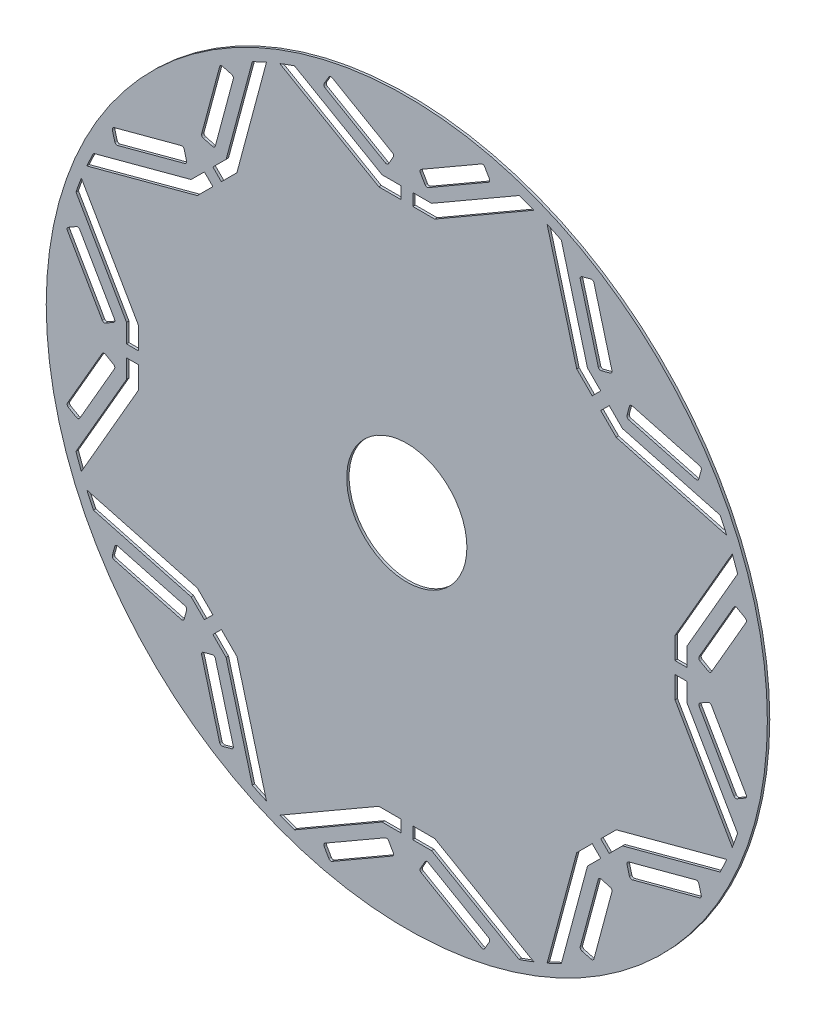
from build123d import *

# Parameters (mm, degrees)
ROTOR_SKETCH_R      = 45
ROTOR_SKETCH_R_2    = 7.5
BOSS_EXTRUDE1_DEPTH = 0.15
CUT_EXTRUDE1_DEPTH  = 64.64031741


with BuildPart() as part:
    # Rotor sketch → Boss-Extrude1 (new, symmetric)
    with BuildSketch(Plane.XY):
        Circle(ROTOR_SKETCH_R)
        Circle(ROTOR_SKETCH_R_2, mode=Mode.SUBTRACT)
        with BuildLine():
            Line((2.683949748, 36.477135035), (10.201050252, 40.817135035))
            ThreePointArc((10.201050252, 40.817135035), (10.340828, 40.999296943), (10.310857874, 41.226942656))
            Line((10.310857874, 41.226942656), (9.725857874, 42.240192379))
            ThreePointArc((9.725857874, 42.240192379), (9.543695966, 42.379970127), (9.316050252, 42.35))
            Line((9.316050252, 42.35), (1.798949748, 38.01))
            ThreePointArc((1.798949748, 38.01), (1.659172, 37.827838092), (1.689142126, 37.600192379))
            Line((1.689142126, 37.600192379), (2.274142126, 36.586942656))
            ThreePointArc((2.274142126, 36.586942656), (2.456304034, 36.447164909), (2.683949748, 36.477135035))
        make_face(mode=Mode.SUBTRACT)
        with BuildLine():
            Line((-1.798949748, 38.01), (-9.316050252, 42.35))
            ThreePointArc((-9.316050252, 42.35), (-9.543695966, 42.379970127), (-9.725857874, 42.240192379))
            Line((-9.725857874, 42.240192379), (-10.310857874, 41.226942656))
            ThreePointArc((-10.310857874, 41.226942656), (-10.340828, 40.999296943), (-10.201050252, 40.817135035))
            Line((-10.201050252, 40.817135035), (-2.683949748, 36.477135035))
            ThreePointArc((-2.683949748, 36.477135035), (-2.456304034, 36.447164909), (-2.274142126, 36.586942656))
            Line((-2.274142126, 36.586942656), (-1.689142126, 37.600192379))
            ThreePointArc((-1.689142126, 37.600192379), (-1.659172, 37.827838092), (-1.798949748, 38.01))
        make_face(mode=Mode.SUBTRACT)
        with BuildLine():
            Line((25.605079187, 28.149178318), (23.358529876, 36.533414491))
            ThreePointArc((23.358529876, 36.533414491), (23.218752128, 36.715576398), (22.991106414, 36.745546525))
            Line((22.991106414, 36.745546525), (21.860973198, 36.442728242))
            ThreePointArc((21.860973198, 36.442728242), (21.67881129, 36.302950494), (21.648841163, 36.075304781))
            Line((21.648841163, 36.075304781), (23.895390475, 27.691068609))
            ThreePointArc((23.895390475, 27.691068609), (24.035168223, 27.508906701), (24.262813936, 27.478936574))
            Line((24.262813936, 27.478936574), (25.392947153, 27.781754857))
            ThreePointArc((25.392947153, 27.781754857), (25.575109061, 27.921532605), (25.605079187, 28.149178318))
        make_face(mode=Mode.SUBTRACT)
        with BuildLine():
            Line((27.478936574, 24.262813936), (27.781754857, 25.392947153))
            ThreePointArc((27.781754857, 25.392947153), (27.921532605, 25.575109061), (28.149178318, 25.605079187))
            Line((28.149178318, 25.605079187), (36.533414491, 23.358529876))
            ThreePointArc((36.533414491, 23.358529876), (36.715576398, 23.218752128), (36.745546525, 22.991106414))
            Line((36.745546525, 22.991106414), (36.442728242, 21.860973198))
            ThreePointArc((36.442728242, 21.860973198), (36.302950494, 21.67881129), (36.075304781, 21.648841163))
            Line((36.075304781, 21.648841163), (27.691068609, 23.895390475))
            ThreePointArc((27.691068609, 23.895390475), (27.508906701, 24.035168223), (27.478936574, 24.262813936))
        make_face(mode=Mode.SUBTRACT)
        with BuildLine():
            Line((38.01, 1.798949748), (42.35, 9.316050252))
            ThreePointArc((42.35, 9.316050252), (42.379970127, 9.543695966), (42.240192379, 9.725857874))
            Line((42.240192379, 9.725857874), (41.226942656, 10.310857874))
            ThreePointArc((41.226942656, 10.310857874), (40.999296943, 10.340828), (40.817135035, 10.201050252))
            Line((40.817135035, 10.201050252), (36.477135035, 2.683949748))
            ThreePointArc((36.477135035, 2.683949748), (36.447164909, 2.456304034), (36.586942656, 2.274142126))
            Line((36.586942656, 2.274142126), (37.600192379, 1.689142126))
            ThreePointArc((37.600192379, 1.689142126), (37.827838092, 1.659172), (38.01, 1.798949748))
        make_face(mode=Mode.SUBTRACT)
        with BuildLine():
            Line((36.586942656, -2.274142126), (37.600192379, -1.689142126))
            ThreePointArc((37.600192379, -1.689142126), (37.827838092, -1.659172), (38.01, -1.798949748))
            Line((38.01, -1.798949748), (42.35, -9.316050252))
            ThreePointArc((42.35, -9.316050252), (42.379970127, -9.543695966), (42.240192379, -9.725857874))
            Line((42.240192379, -9.725857874), (41.226942656, -10.310857874))
            ThreePointArc((41.226942656, -10.310857874), (40.999296943, -10.340828), (40.817135035, -10.201050252))
            Line((40.817135035, -10.201050252), (36.477135035, -2.683949748))
            ThreePointArc((36.477135035, -2.683949748), (36.447164909, -2.456304034), (36.586942656, -2.274142126))
        make_face(mode=Mode.SUBTRACT)
        with BuildLine():
            Line((28.149178318, -25.605079187), (36.533414491, -23.358529876))
            ThreePointArc((36.533414491, -23.358529876), (36.715576398, -23.218752128), (36.745546525, -22.991106414))
            Line((36.745546525, -22.991106414), (36.442728242, -21.860973198))
            ThreePointArc((36.442728242, -21.860973198), (36.302950494, -21.67881129), (36.075304781, -21.648841163))
            Line((36.075304781, -21.648841163), (27.691068609, -23.895390475))
            ThreePointArc((27.691068609, -23.895390475), (27.508906701, -24.035168223), (27.478936574, -24.262813936))
            Line((27.478936574, -24.262813936), (27.781754857, -25.392947153))
            ThreePointArc((27.781754857, -25.392947153), (27.921532605, -25.575109061), (28.149178318, -25.605079187))
        make_face(mode=Mode.SUBTRACT)
        with BuildLine():
            Line((24.262813936, -27.478936574), (25.392947153, -27.781754857))
            ThreePointArc((25.392947153, -27.781754857), (25.575109061, -27.921532605), (25.605079187, -28.149178318))
            Line((25.605079187, -28.149178318), (23.358529876, -36.533414491))
            ThreePointArc((23.358529876, -36.533414491), (23.218752128, -36.715576398), (22.991106414, -36.745546525))
            Line((22.991106414, -36.745546525), (21.860973198, -36.442728242))
            ThreePointArc((21.860973198, -36.442728242), (21.67881129, -36.302950494), (21.648841163, -36.075304781))
            Line((21.648841163, -36.075304781), (23.895390475, -27.691068609))
            ThreePointArc((23.895390475, -27.691068609), (24.035168223, -27.508906701), (24.262813936, -27.478936574))
        make_face(mode=Mode.SUBTRACT)
        with BuildLine():
            Line((1.798949748, -38.01), (9.316050252, -42.35))
            ThreePointArc((9.316050252, -42.35), (9.543695966, -42.379970127), (9.725857874, -42.240192379))
            Line((9.725857874, -42.240192379), (10.310857874, -41.226942656))
            ThreePointArc((10.310857874, -41.226942656), (10.340828, -40.999296943), (10.201050252, -40.817135035))
            Line((10.201050252, -40.817135035), (2.683949748, -36.477135035))
            ThreePointArc((2.683949748, -36.477135035), (2.456304034, -36.447164909), (2.274142126, -36.586942656))
            Line((2.274142126, -36.586942656), (1.689142126, -37.600192379))
            ThreePointArc((1.689142126, -37.600192379), (1.659172, -37.827838092), (1.798949748, -38.01))
        make_face(mode=Mode.SUBTRACT)
        with BuildLine():
            Line((-2.274142126, -36.586942656), (-1.689142126, -37.600192379))
            ThreePointArc((-1.689142126, -37.600192379), (-1.659172, -37.827838092), (-1.798949748, -38.01))
            Line((-1.798949748, -38.01), (-9.316050252, -42.35))
            ThreePointArc((-9.316050252, -42.35), (-9.543695966, -42.379970127), (-9.725857874, -42.240192379))
            Line((-9.725857874, -42.240192379), (-10.310857874, -41.226942656))
            ThreePointArc((-10.310857874, -41.226942656), (-10.340828, -40.999296943), (-10.201050252, -40.817135035))
            Line((-10.201050252, -40.817135035), (-2.683949748, -36.477135035))
            ThreePointArc((-2.683949748, -36.477135035), (-2.456304034, -36.447164909), (-2.274142126, -36.586942656))
        make_face(mode=Mode.SUBTRACT)
        with BuildLine():
            Line((-25.605079187, -28.149178318), (-23.358529876, -36.533414491))
            ThreePointArc((-23.358529876, -36.533414491), (-23.218752128, -36.715576398), (-22.991106414, -36.745546525))
            Line((-22.991106414, -36.745546525), (-21.860973198, -36.442728242))
            ThreePointArc((-21.860973198, -36.442728242), (-21.67881129, -36.302950494), (-21.648841163, -36.075304781))
            Line((-21.648841163, -36.075304781), (-23.895390475, -27.691068609))
            ThreePointArc((-23.895390475, -27.691068609), (-24.035168223, -27.508906701), (-24.262813936, -27.478936574))
            Line((-24.262813936, -27.478936574), (-25.392947153, -27.781754857))
            ThreePointArc((-25.392947153, -27.781754857), (-25.575109061, -27.921532605), (-25.605079187, -28.149178318))
        make_face(mode=Mode.SUBTRACT)
        with BuildLine():
            Line((-27.478936574, -24.262813936), (-27.781754857, -25.392947153))
            ThreePointArc((-27.781754857, -25.392947153), (-27.921532605, -25.575109061), (-28.149178318, -25.605079187))
            Line((-28.149178318, -25.605079187), (-36.533414491, -23.358529876))
            ThreePointArc((-36.533414491, -23.358529876), (-36.715576398, -23.218752128), (-36.745546525, -22.991106414))
            Line((-36.745546525, -22.991106414), (-36.442728242, -21.860973198))
            ThreePointArc((-36.442728242, -21.860973198), (-36.302950494, -21.67881129), (-36.075304781, -21.648841163))
            Line((-36.075304781, -21.648841163), (-27.691068609, -23.895390475))
            ThreePointArc((-27.691068609, -23.895390475), (-27.508906701, -24.035168223), (-27.478936574, -24.262813936))
        make_face(mode=Mode.SUBTRACT)
        with BuildLine():
            Line((-38.01, -1.798949748), (-42.35, -9.316050252))
            ThreePointArc((-42.35, -9.316050252), (-42.379970127, -9.543695966), (-42.240192379, -9.725857874))
            Line((-42.240192379, -9.725857874), (-41.226942656, -10.310857874))
            ThreePointArc((-41.226942656, -10.310857874), (-40.999296943, -10.340828), (-40.817135035, -10.201050252))
            Line((-40.817135035, -10.201050252), (-36.477135035, -2.683949748))
            ThreePointArc((-36.477135035, -2.683949748), (-36.447164909, -2.456304034), (-36.586942656, -2.274142126))
            Line((-36.586942656, -2.274142126), (-37.600192379, -1.689142126))
            ThreePointArc((-37.600192379, -1.689142126), (-37.827838092, -1.659172), (-38.01, -1.798949748))
        make_face(mode=Mode.SUBTRACT)
        with BuildLine():
            Line((-36.586942656, 2.274142126), (-37.600192379, 1.689142126))
            ThreePointArc((-37.600192379, 1.689142126), (-37.827838092, 1.659172), (-38.01, 1.798949748))
            Line((-38.01, 1.798949748), (-42.35, 9.316050252))
            ThreePointArc((-42.35, 9.316050252), (-42.379970127, 9.543695966), (-42.240192379, 9.725857874))
            Line((-42.240192379, 9.725857874), (-41.226942656, 10.310857874))
            ThreePointArc((-41.226942656, 10.310857874), (-40.999296943, 10.340828), (-40.817135035, 10.201050252))
            Line((-40.817135035, 10.201050252), (-36.477135035, 2.683949748))
            ThreePointArc((-36.477135035, 2.683949748), (-36.447164909, 2.456304034), (-36.586942656, 2.274142126))
        make_face(mode=Mode.SUBTRACT)
        with BuildLine():
            Line((-28.149178318, 25.605079187), (-36.533414491, 23.358529876))
            ThreePointArc((-36.533414491, 23.358529876), (-36.715576398, 23.218752128), (-36.745546525, 22.991106414))
            Line((-36.745546525, 22.991106414), (-36.442728242, 21.860973198))
            ThreePointArc((-36.442728242, 21.860973198), (-36.302950494, 21.67881129), (-36.075304781, 21.648841163))
            Line((-36.075304781, 21.648841163), (-27.691068609, 23.895390475))
            ThreePointArc((-27.691068609, 23.895390475), (-27.508906701, 24.035168223), (-27.478936574, 24.262813936))
            Line((-27.478936574, 24.262813936), (-27.781754857, 25.392947153))
            ThreePointArc((-27.781754857, 25.392947153), (-27.921532605, 25.575109061), (-28.149178318, 25.605079187))
        make_face(mode=Mode.SUBTRACT)
        with BuildLine():
            Line((-24.262813936, 27.478936574), (-25.392947153, 27.781754857))
            ThreePointArc((-25.392947153, 27.781754857), (-25.575109061, 27.921532605), (-25.605079187, 28.149178318))
            Line((-25.605079187, 28.149178318), (-23.358529876, 36.533414491))
            ThreePointArc((-23.358529876, 36.533414491), (-23.218752128, 36.715576398), (-22.991106414, 36.745546525))
            Line((-22.991106414, 36.745546525), (-21.860973198, 36.442728242))
            ThreePointArc((-21.860973198, 36.442728242), (-21.67881129, 36.302950494), (-21.648841163, 36.075304781))
            Line((-21.648841163, 36.075304781), (-23.895390475, 27.691068609))
            ThreePointArc((-23.895390475, 27.691068609), (-24.035168223, 27.508906701), (-24.262813936, 27.478936574))
        make_face(mode=Mode.SUBTRACT)
    extrude(amount=BOSS_EXTRUDE1_DEPTH, both=True)

    # Saliency grooves → Cut-Extrude1 (cut, through all)
    with BuildSketch(Plane.XY.offset(0.15)):
        with BuildLine():
            Line((-15.852588486, 40.61595054), (-3.487797325, 33.477135035))
            Line((-3.487797325, 33.477135035), (-0.75, 33.477135035))
            Line((-0.75, 33.477135035), (-0.75, 34.977135035))
            Line((-0.75, 34.977135035), (-3.085873536, 34.977135035))
            Line((-3.085873536, 34.977135035), (-14.01391281, 41.286441452))
            ThreePointArc((-14.01391281, 41.286441452), (-14.937013237, 40.961514078), (-15.852588486, 40.61595054))
        make_face()
        with BuildLine():
            Line((-21.205664058, 26.138154338), (-17.510341234, 39.929286869))
            ThreePointArc((-17.510341234, 39.929286869), (-18.402101022, 39.526227723), (-19.284589943, 39.103255501))
            Line((-19.284589943, 39.103255501), (-22.550527267, 26.914611473))
            Line((-22.550527267, 26.914611473), (-24.202239284, 25.262899456))
            Line((-24.202239284, 25.262899456), (-23.141579112, 24.202239284))
            Line((-23.141579112, 24.202239284), (-21.205664058, 26.138154338))
        make_face()
        with BuildLine():
            ThreePointArc((15.852588486, 40.61595054), (14.937013237, 40.961514078), (14.01391281, 41.286441452))
            Line((14.01391281, 41.286441452), (3.085873536, 34.977135035))
            Line((3.085873536, 34.977135035), (0.75, 34.977135035))
            Line((0.75, 34.977135035), (0.75, 33.477135035))
            Line((0.75, 33.477135035), (3.487797325, 33.477135035))
            Line((3.487797325, 33.477135035), (15.852588486, 40.61595054))
        make_face()
        with BuildLine():
            Line((-26.914611473, 22.550527267), (-39.103255501, 19.284589943))
            ThreePointArc((-39.103255501, 19.284589943), (-39.526227723, 18.402101022), (-39.929286869, 17.510341234))
            Line((-39.929286869, 17.510341234), (-26.138154338, 21.205664058))
            Line((-26.138154338, 21.205664058), (-24.202239284, 23.141579112))
            Line((-24.202239284, 23.141579112), (-25.262899456, 24.202239284))
            Line((-25.262899456, 24.202239284), (-26.914611473, 22.550527267))
        make_face()
        with BuildLine():
            ThreePointArc((19.284589943, 39.103255501), (18.402101022, 39.526227723), (17.510341234, 39.929286869))
            Line((17.510341234, 39.929286869), (21.205664058, 26.138154338))
            Line((21.205664058, 26.138154338), (23.141579112, 24.202239284))
            Line((23.141579112, 24.202239284), (24.202239284, 25.262899456))
            Line((24.202239284, 25.262899456), (22.550527267, 26.914611473))
            Line((22.550527267, 26.914611473), (19.284589943, 39.103255501))
        make_face()
        with BuildLine():
            Line((-33.477135035, 3.487797325), (-40.61595054, 15.852588486))
            ThreePointArc((-40.61595054, 15.852588486), (-40.961514078, 14.937013237), (-41.286441452, 14.01391281))
            Line((-41.286441452, 14.01391281), (-34.977135035, 3.085873536))
            Line((-34.977135035, 3.085873536), (-34.977135035, 0.75))
            Line((-34.977135035, 0.75), (-33.477135035, 0.75))
            Line((-33.477135035, 0.75), (-33.477135035, 3.487797325))
        make_face()
        with BuildLine():
            ThreePointArc((39.929286869, 17.510341234), (39.526227723, 18.402101022), (39.103255501, 19.284589943))
            Line((39.103255501, 19.284589943), (26.914611473, 22.550527267))
            Line((26.914611473, 22.550527267), (25.262899456, 24.202239284))
            Line((25.262899456, 24.202239284), (24.202239284, 23.141579112))
            Line((24.202239284, 23.141579112), (26.138154338, 21.205664058))
            Line((26.138154338, 21.205664058), (39.929286869, 17.510341234))
        make_face()
        with BuildLine():
            Line((-34.977135035, -3.085873536), (-41.286441452, -14.01391281))
            ThreePointArc((-41.286441452, -14.01391281), (-40.961514078, -14.937013237), (-40.61595054, -15.852588486))
            Line((-40.61595054, -15.852588486), (-33.477135035, -3.487797325))
            Line((-33.477135035, -3.487797325), (-33.477135035, -0.75))
            Line((-33.477135035, -0.75), (-34.977135035, -0.75))
            Line((-34.977135035, -0.75), (-34.977135035, -3.085873536))
        make_face()
        with BuildLine():
            ThreePointArc((41.286441452, 14.01391281), (40.961514078, 14.937013237), (40.61595054, 15.852588486))
            Line((40.61595054, 15.852588486), (33.477135035, 3.487797325))
            Line((33.477135035, 3.487797325), (33.477135035, 0.75))
            Line((33.477135035, 0.75), (34.977135035, 0.75))
            Line((34.977135035, 0.75), (34.977135035, 3.085873536))
            Line((34.977135035, 3.085873536), (41.286441452, 14.01391281))
        make_face()
        with BuildLine():
            Line((-26.138154338, -21.205664058), (-39.929286869, -17.510341234))
            ThreePointArc((-39.929286869, -17.510341234), (-39.526227723, -18.402101022), (-39.103255501, -19.284589943))
            Line((-39.103255501, -19.284589943), (-26.914611473, -22.550527267))
            Line((-26.914611473, -22.550527267), (-25.262899456, -24.202239284))
            Line((-25.262899456, -24.202239284), (-24.202239284, -23.141579112))
            Line((-24.202239284, -23.141579112), (-26.138154338, -21.205664058))
        make_face()
        with BuildLine():
            ThreePointArc((40.61595054, -15.852588486), (40.961514078, -14.937013237), (41.286441452, -14.01391281))
            Line((41.286441452, -14.01391281), (34.977135035, -3.085873536))
            Line((34.977135035, -3.085873536), (34.977135035, -0.75))
            Line((34.977135035, -0.75), (33.477135035, -0.75))
            Line((33.477135035, -0.75), (33.477135035, -3.487797325))
            Line((33.477135035, -3.487797325), (40.61595054, -15.852588486))
        make_face()
        with BuildLine():
            Line((-22.550527267, -26.914611473), (-19.284589943, -39.103255501))
            ThreePointArc((-19.284589943, -39.103255501), (-18.402101022, -39.526227723), (-17.510341234, -39.929286869))
            Line((-17.510341234, -39.929286869), (-21.205664058, -26.138154338))
            Line((-21.205664058, -26.138154338), (-23.141579112, -24.202239284))
            Line((-23.141579112, -24.202239284), (-24.202239284, -25.262899456))
            Line((-24.202239284, -25.262899456), (-22.550527267, -26.914611473))
        make_face()
        with BuildLine():
            ThreePointArc((39.103255501, -19.284589943), (39.526227723, -18.402101022), (39.929286869, -17.510341234))
            Line((39.929286869, -17.510341234), (26.138154338, -21.205664058))
            Line((26.138154338, -21.205664058), (24.202239284, -23.141579112))
            Line((24.202239284, -23.141579112), (25.262899456, -24.202239284))
            Line((25.262899456, -24.202239284), (26.914611473, -22.550527267))
            Line((26.914611473, -22.550527267), (39.103255501, -19.284589943))
        make_face()
        with BuildLine():
            Line((-3.487797325, -33.477135035), (-15.852588486, -40.61595054))
            ThreePointArc((-15.852588486, -40.61595054), (-14.937013237, -40.961514078), (-14.01391281, -41.286441452))
            Line((-14.01391281, -41.286441452), (-3.085873536, -34.977135035))
            Line((-3.085873536, -34.977135035), (-0.75, -34.977135035))
            Line((-0.75, -34.977135035), (-0.75, -33.477135035))
            Line((-0.75, -33.477135035), (-3.487797325, -33.477135035))
        make_face()
        with BuildLine():
            ThreePointArc((17.510341234, -39.929286869), (18.402101022, -39.526227723), (19.284589943, -39.103255501))
            Line((19.284589943, -39.103255501), (22.550527267, -26.914611473))
            Line((22.550527267, -26.914611473), (24.202239284, -25.262899456))
            Line((24.202239284, -25.262899456), (23.141579112, -24.202239284))
            Line((23.141579112, -24.202239284), (21.205664058, -26.138154338))
            Line((21.205664058, -26.138154338), (17.510341234, -39.929286869))
        make_face()
        with BuildLine():
            Line((3.085873536, -34.977135035), (14.01391281, -41.286441452))
            ThreePointArc((14.01391281, -41.286441452), (14.937013237, -40.961514078), (15.852588486, -40.61595054))
            Line((15.852588486, -40.61595054), (3.487797325, -33.477135035))
            Line((3.487797325, -33.477135035), (0.75, -33.477135035))
            Line((0.75, -33.477135035), (0.75, -34.977135035))
            Line((0.75, -34.977135035), (3.085873536, -34.977135035))
        make_face()
    extrude(amount=-CUT_EXTRUDE1_DEPTH, mode=Mode.SUBTRACT)


solid = part.part
